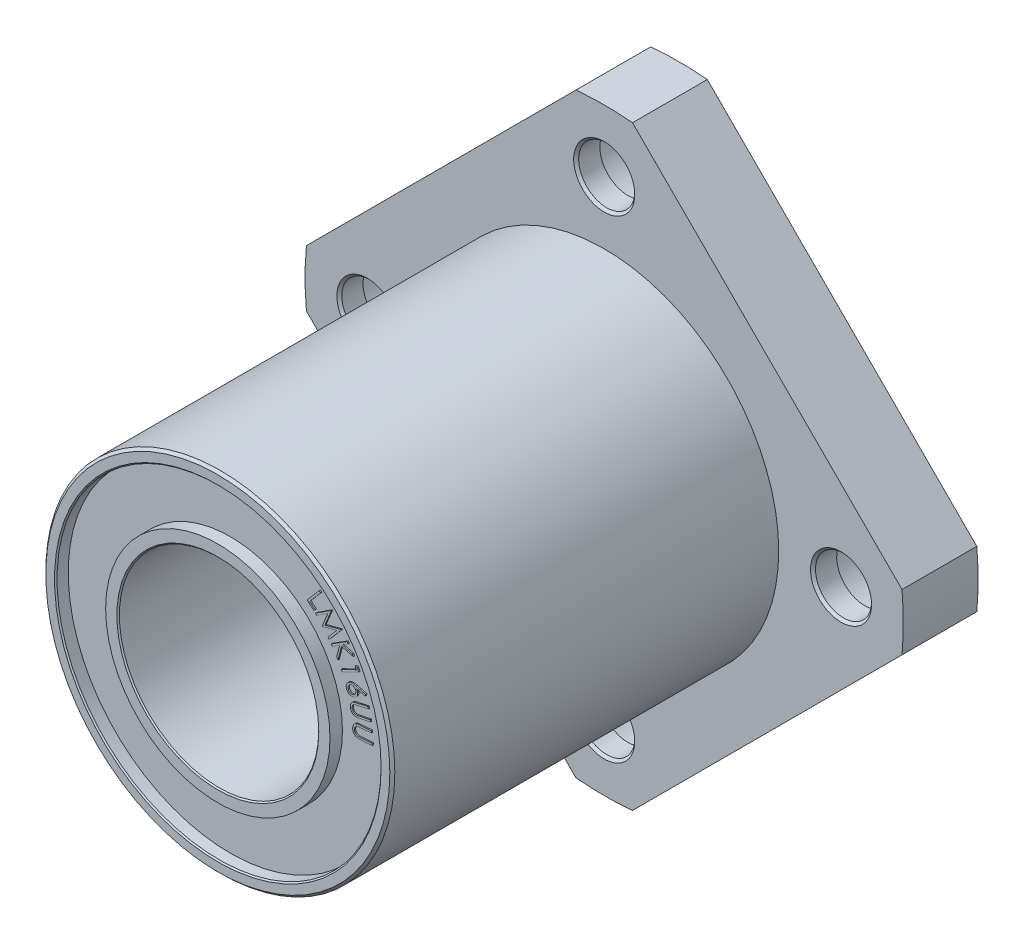
from build123d import *

# Parameters (mm, degrees)
BOSS_EXTRUDE1_DEPTH = 6
SKETCH2_R           = 14
BOSS_EXTRUDE2_DEPTH = 31
SKETCH3_R           = 3.75
CUT_EXTRUDE1_DEPTH  = 4.1
SKETCH4_R           = 2.25
CUT_EXTRUDE2_DEPTH  = 1.9
CHAMFER1_SIZE       = 0.2
SKETCH5_R           = 8
CUT_EXTRUDE3_DEPTH  = 51.209560843
SKETCH6_R           = 13
SKETCH6_R_2         = 9
CUT_EXTRUDE4_DEPTH  = 1
CUT_EXTRUDE5_START  = -1
SKETCH7_R           = 13
SKETCH7_R_2         = 9
CUT_EXTRUDE5_DEPTH  = 1
BOSS_EXTRUDE3_DEPTH = 0.1
CHAMFER2_SIZE       = 0.1
BOSS_EXTRUDE4_DEPTH = 0.1


# Read off the part's stored shape, not the designer's step: CirPattern1
with BuildPart() as part:
    # Sketch1 → Boss-Extrude1 (new body)
    with BuildSketch(Plane.XY):
        with BuildLine():
            Line((-2.270601297, 23.892349607), (-23.892349607, 2.270601297))
            ThreePointArc((-23.892349607, 2.270601297), (-24, 0), (-23.892349607, -2.270601297))
            Line((-23.892349607, -2.270601297), (-2.270601297, -23.892349607))
            ThreePointArc((-2.270601297, -23.892349607), (0, -24), (2.270601297, -23.892349607))
            Line((2.270601297, -23.892349607), (23.892349607, -2.270601297))
            ThreePointArc((23.892349607, -2.270601297), (24, 0), (23.892349607, 2.270601297))
            Line((23.892349607, 2.270601297), (2.270601297, 23.892349607))
            ThreePointArc((2.270601297, 23.892349607), (0, 24), (-2.270601297, 23.892349607))
        make_face()
    extrude(amount=BOSS_EXTRUDE1_DEPTH)

    # Sketch2 → Boss-Extrude2 (add)
    with BuildSketch(Plane.XY.offset(6)):
        Circle(SKETCH2_R)
    extrude(amount=BOSS_EXTRUDE2_DEPTH)

    # Sketch3 → Cut-Extrude1 (cut)
    with BuildSketch(Plane(origin=(0, 0, 0), x_dir=(-1, 0, 0), z_dir=(0, 0, -1))):
        with Locations((0, 19)):
            Circle(SKETCH3_R)
    extrude(amount=-CUT_EXTRUDE1_DEPTH, mode=Mode.SUBTRACT)

    # Sketch4 → Cut-Extrude2 (cut)
    with BuildSketch(Plane(origin=(0, 0, 4.1), x_dir=(-1, 0, 0), z_dir=(0, 0, -1))):
        with Locations((0, 19)):
            Circle(SKETCH4_R)
    extrude(amount=-CUT_EXTRUDE2_DEPTH, mode=Mode.SUBTRACT)

    # Chamfer1
    chamfer1_edges = [part.edges().sort_by_distance(p)[0] for p in [
        (-14, 0, 37),
        (3.75, 19, 0),
        (2.25, 19, 6),
    ]]
    chamfer(chamfer1_edges, length=CHAMFER1_SIZE)

    # CirPattern1 outline → CirPattern1 (revolve, cut)
    with BuildSketch(Plane(origin=(-19, 0, 0), x_dir=(1, 0, 0), z_dir=(0, -1, 0))):
        Polygon((0, 0), (3.95, 0), (3.75, 0.2), (3.75, 4.1), (2.25, 4.1), (2.25, 5.8), (2.45, 6), (0, 6), align=None)
    revolve(axis=Axis((-19, 0, 0), (0, 0, 1)), mode=Mode.SUBTRACT)

    # CirPattern1 2 outline → CirPattern1 2 (revolve, cut)
    with BuildSketch(Plane.XZ.offset(19)):
        Polygon((0, 0), (3.95, 0), (3.75, 0.2), (3.75, 4.1), (2.25, 4.1), (2.25, 5.8), (2.45, 6), (0, 6), align=None)
    revolve(axis=Axis((0, -19, 0), (0, 0, 1)), mode=Mode.SUBTRACT)

    # CirPattern1 3 outline → CirPattern1 3 (revolve, cut)
    with BuildSketch(Plane(origin=(19, 0, 0), x_dir=(1, 0, 0), z_dir=(0, -1, 0))):
        Polygon((0, 0), (3.95, 0), (3.75, 0.2), (3.75, 4.1), (2.25, 4.1), (2.25, 5.8), (2.45, 6), (0, 6), align=None)
    revolve(axis=Axis((19, 0, 0), (0, 0, 1)), mode=Mode.SUBTRACT)

    # Sketch5 → Cut-Extrude3 (cut, through all)
    with BuildSketch(Plane.XY.offset(37)):
        Circle(SKETCH5_R)
    extrude(amount=-CUT_EXTRUDE3_DEPTH, mode=Mode.SUBTRACT)

    # Sketch6 → Cut-Extrude4 (cut)
    with BuildSketch(Plane.XY.offset(37)):
        Circle(SKETCH6_R)
        Circle(SKETCH6_R_2, mode=Mode.SUBTRACT)
    extrude(amount=-CUT_EXTRUDE4_DEPTH, mode=Mode.SUBTRACT)

    # Sketch7 → Cut-Extrude5 (cut)
    with BuildSketch(Plane(origin=(0, 0, 0), x_dir=(-1, 0, 0), z_dir=(0, 0, -1)).offset(CUT_EXTRUDE5_START)):
        with Locations(Location((0, 0, 0), (0, 0, 180))):
            Circle(SKETCH7_R)
        with Locations(Location((0, 0, 0), (0, 0, 180))):
            Circle(SKETCH7_R_2, mode=Mode.SUBTRACT)
    extrude(amount=CUT_EXTRUDE5_DEPTH, mode=Mode.SUBTRACT)

    # Sketch8 → Boss-Extrude3 (add)
    # profile 1 of 7: a face of its own
    with BuildSketch(Plane.XY.offset(36)):
        with BuildLine():
            Line((11.415137259, 1.260998935), (11.425654086, 1.111960473))
            Line((11.425654086, 1.111960473), (10.52511322, 1.047357108))
            add(Edge.make_bspline(
                [(10.52511322, 1.047357108), (10.512391372, 1.046475771), (10.488143423, 1.044795935), (10.453687061, 1.042095703), (10.423029036, 1.039461171), (10.396208389, 1.036629482), (10.373142743, 1.034374521), (10.353907919, 1.031971865), (10.338448907, 1.029688122), (10.329493338, 1.027762745), (10.325593989, 1.026924416)],
                knots=[0, 0, 0, 0, 1.525072541, 2.906801162, 4.133345386, 5.204860418, 6.132162282, 6.904746193, 7.523115038, 8, 8, 8, 8], degree=3))
            add(Edge.make_bspline(
                [(10.325593989, 1.026924416), (10.311588451, 1.023717628), (10.28447674, 1.017509977), (10.246234893, 1.003532982), (10.211836857, 0.98621593), (10.181099719, 0.965110848), (10.153685059, 0.939717023), (10.129952278, 0.908704404), (10.108588135, 0.872847488), (10.090766505, 0.832506456), (10.076511148, 0.78995449), (10.066732056, 0.746697166), (10.061902865, 0.703504793), (10.063019767, 0.674868036), (10.063574759, 0.660638358)],
                knots=[0, 0, 0, 0, 1.043382883, 2.019764934, 2.950812171, 3.835190224, 4.721034932, 5.654412561, 6.663092303, 7.748074903, 8.852970654, 9.919631682, 10.966259617, 12, 12, 12, 12], degree=3))
            add(Edge.make_bspline(
                [(10.063574759, 0.660638358), (10.064748948, 0.648363032), (10.067083882, 0.623952927), (10.076415054, 0.588374651), (10.088098548, 0.553497259), (10.104503384, 0.520402071), (10.123812326, 0.48912192), (10.146625223, 0.460789625), (10.171791171, 0.435061906), (10.200099231, 0.412642724), (10.231132784, 0.39334851), (10.26495601, 0.377484107), (10.301400397, 0.364636232), (10.326925052, 0.358895417), (10.340017066, 0.355950858)],
                knots=[0, 0, 0, 0, 0.998619411, 1.98580514, 2.974994631, 3.977835159, 4.974204828, 5.951175003, 6.922045832, 7.887599396, 8.872777288, 9.879427914, 10.912323838, 12, 12, 12, 12], degree=3))
            add(Edge.make_bspline(
                [(10.340017066, 0.355950858), (10.34541578, 0.355063537), (10.357459005, 0.353084138), (10.377565431, 0.351938052), (10.401403658, 0.350878065), (10.428960691, 0.351216478), (10.460225752, 0.351177345), (10.495074187, 0.353010343), (10.533638896, 0.355034644), (10.560571717, 0.356818481), (10.574692547, 0.357753743)],
                knots=[0, 0, 0, 0, 0.558156925, 1.245112992, 2.053442056, 2.994109282, 4.057521389, 5.244681348, 6.555391349, 8, 8, 8, 8], degree=3))
            Line((10.574692547, 0.357753743), (11.475233412, 0.422357108))
            Line((11.475233412, 0.422357108), (11.485750239, 0.273318646))
            Line((11.485750239, 0.273318646), (10.585209374, 0.208715281))
            add(Edge.make_bspline(
                [(10.585209374, 0.208715281), (10.568988887, 0.207615452), (10.537270226, 0.205464769), (10.490769042, 0.203966696), (10.446479716, 0.204025631), (10.404483142, 0.205092721), (10.364777297, 0.207744087), (10.327502363, 0.212004326), (10.292473797, 0.21730545), (10.259539162, 0.224204707), (10.227991606, 0.232894833), (10.197711601, 0.244437461), (10.168052959, 0.258183982), (10.139588387, 0.275007273), (10.11141359, 0.293492411), (10.084451563, 0.314998062), (10.058161151, 0.338794364), (10.033125974, 0.365076119), (10.009658559, 0.393412318), (9.98897555, 0.423861886), (9.970692667, 0.455932401), (9.955500839, 0.489904774), (9.942794527, 0.525559116), (9.932864333, 0.562826672), (9.925955641, 0.601954242), (9.923369394, 0.628664965), (9.922048316, 0.642309031)],
                knots=[0, 0, 0, 0, 1.29790519, 2.538013593, 3.713504963, 4.833477405, 5.891471315, 6.889342099, 7.828041886, 8.718857869, 9.574525008, 10.437447634, 11.303144641, 12.180944757, 13.074734734, 13.991411698, 14.931132735, 15.903953804, 16.886877875, 17.865008677, 18.839012189, 19.830389656, 20.831970248, 21.858054395, 22.90587578, 24, 24, 24, 24], degree=3))
            add(Edge.make_bspline(
                [(9.922048316, 0.642309031), (9.921262384, 0.657127623), (9.919717529, 0.686255574), (9.920601945, 0.729338353), (9.924530997, 0.770899719), (9.931172318, 0.811057158), (9.940357212, 0.849900984), (9.952776226, 0.887236584), (9.967892546, 0.923175888), (9.98548152, 0.957585544), (10.005607491, 0.990030884), (10.027819258, 1.020075532), (10.051980902, 1.047691777), (10.078223384, 1.072482659), (10.105926121, 1.095449658), (10.13608798, 1.115113273), (10.168053714, 1.132430839), (10.190490061, 1.141796388), (10.201795912, 1.146515762)],
                knots=[0, 0, 0, 0, 1.150349316, 2.261167586, 3.337655153, 4.384602257, 5.41497043, 6.42926185, 7.431710093, 8.435511189, 9.422558622, 10.388700234, 11.329699416, 12.263524504, 13.185355934, 14.115881161, 15.050577791, 16, 16, 16, 16], degree=3))
            add(Edge.make_bspline(
                [(10.201795912, 1.146515762), (10.209672645, 1.149334886), (10.22663518, 1.155405865), (10.254843223, 1.162632745), (10.287282385, 1.169889306), (10.32416981, 1.176452641), (10.365508546, 1.181968832), (10.411189637, 1.187344485), (10.461347577, 1.192613247), (10.496358047, 1.19510008), (10.514596393, 1.19639557)],
                knots=[0, 0, 0, 0, 0.63178644, 1.360551357, 2.197781047, 3.143358464, 4.190032368, 5.348333603, 6.618641489, 8, 8, 8, 8], degree=3))
            Line((10.514596393, 1.19639557), (11.415137259, 1.260998935))
        make_face()
    # profile 2 of 7: a face of its own
    with BuildSketch(Plane.XY.offset(36)):
        with BuildLine():
            Line((11.139128228, 2.809397239), (11.170678709, 2.663363585))
            Line((11.170678709, 2.663363585), (10.286664286, 2.472257816))
            add(Edge.make_bspline(
                [(10.286664286, 2.472257816), (10.274143383, 2.46955864), (10.250386782, 2.464437344), (10.216669763, 2.45708698), (10.186920932, 2.449653343), (10.160725192, 2.443466028), (10.138185915, 2.43775622), (10.119339797, 2.432703256), (10.104259171, 2.428333519), (10.095647169, 2.425217247), (10.091952748, 2.423880412)],
                knots=[0, 0, 0, 0, 1.531423077, 2.905653596, 4.12553918, 5.197303879, 6.123816941, 6.905239634, 7.530364024, 8, 8, 8, 8], degree=3))
            add(Edge.make_bspline(
                [(10.091952748, 2.423880412), (10.07849968, 2.418772179), (10.05238323, 2.408855562), (10.016527178, 2.389471955), (9.984836589, 2.367432873), (9.957276334, 2.342271867), (9.933964761, 2.312932029), (9.914254712, 2.279182209), (9.8986246, 2.240417753), (9.886223971, 2.198051791), (9.877846932, 2.153769767), (9.87449667, 2.109433195), (9.876097582, 2.065924142), (9.881181399, 2.037720924), (9.883719574, 2.023640027)],
                knots=[0, 0, 0, 0, 1.042784615, 2.024358541, 2.947413012, 3.836807914, 4.720607584, 5.655054889, 6.661475998, 7.744185415, 8.852688997, 9.923562491, 10.963306172, 12, 12, 12, 12], degree=3))
            add(Edge.make_bspline(
                [(9.883719574, 2.023640027), (9.886637118, 2.011732182), (9.892457137, 1.987977991), (9.906343536, 1.953923222), (9.923515655, 1.921286225), (9.944120679, 1.89053096), (9.967791419, 1.862207094), (9.994361632, 1.837276172), (10.023107889, 1.815436438), (10.054124627, 1.796869803), (10.087812227, 1.782633257), (10.123359185, 1.771306467), (10.161315481, 1.764142589), (10.18737823, 1.762077507), (10.200726786, 1.761019835)],
                knots=[0, 0, 0, 0, 0.992542382, 1.979958752, 2.971338459, 3.977793662, 4.974609623, 5.956638373, 6.924335101, 7.896143417, 8.877903688, 9.881834677, 10.915139429, 12, 12, 12, 12], degree=3))
            add(Edge.make_bspline(
                [(10.200726786, 1.761019835), (10.206235967, 1.760975525), (10.218463057, 1.760877183), (10.238634851, 1.761795582), (10.262393242, 1.764294639), (10.289592475, 1.768379641), (10.320462761, 1.773165402), (10.354859224, 1.779090399), (10.392777202, 1.786753917), (10.419181185, 1.792347509), (10.432998421, 1.795274643)],
                knots=[0, 0, 0, 0, 0.562056896, 1.24743041, 2.058877369, 2.998267398, 4.053373643, 5.246223677, 6.558945556, 8, 8, 8, 8], degree=3))
            Line((10.432998421, 1.795274643), (11.317012844, 1.986380412))
            Line((11.317012844, 1.986380412), (11.348563324, 1.840046277))
            Line((11.348563324, 1.840046277), (10.464548901, 1.648940508))
            add(Edge.make_bspline(
                [(10.464548901, 1.648940508), (10.448535743, 1.645673637), (10.417371989, 1.639315869), (10.371524813, 1.631032292), (10.327800009, 1.624868686), (10.286145006, 1.619857956), (10.246545993, 1.616869235), (10.208945502, 1.615557566), (10.173458524, 1.616272763), (10.139699835, 1.618075532), (10.107264631, 1.62271485), (10.075475148, 1.629574043), (10.04428157, 1.639296767), (10.013467523, 1.651271076), (9.983287476, 1.666172671), (9.953468898, 1.683654062), (9.924127781, 1.703831572), (9.895334401, 1.726185697), (9.868054853, 1.750960099), (9.843070865, 1.77814036), (9.820272369, 1.807319876), (9.800690943, 1.83911449), (9.78270622, 1.87245182), (9.767645777, 1.90816707), (9.755446535, 1.946057308), (9.749044989, 1.972214975), (9.745798901, 1.985478969)],
                knots=[0, 0, 0, 0, 1.302698352, 2.535225709, 3.712849897, 4.821988615, 5.878864123, 6.877344351, 7.819562771, 8.707520028, 9.570135128, 10.428305255, 11.297031741, 12.171754054, 13.060823253, 13.976870013, 14.924653063, 15.897263205, 16.880594818, 17.858042546, 18.836956421, 19.827103014, 20.830708993, 21.853876358, 22.911746516, 24, 24, 24, 24], degree=3))
            add(Edge.make_bspline(
                [(9.745798901, 1.985478969), (9.742894087, 2.000069532), (9.73719131, 2.028713949), (9.732190665, 2.071596021), (9.729830694, 2.113368279), (9.731371094, 2.154114395), (9.734609902, 2.193944693), (9.741708837, 2.232804368), (9.751545152, 2.270712545), (9.764517116, 2.307356572), (9.780025294, 2.342304226), (9.797871393, 2.37521598), (9.81761657, 2.406048099), (9.840056839, 2.434426869), (9.864668405, 2.460596475), (9.891661244, 2.484464249), (9.920723686, 2.506244979), (9.941689574, 2.518620659), (9.95222919, 2.52484195)],
                knots=[0, 0, 0, 0, 1.151260563, 2.260172568, 3.339326473, 4.386558457, 5.414290122, 6.430313554, 7.440253402, 8.443263907, 9.436031966, 10.397074162, 11.339097701, 12.266714788, 13.193715939, 14.116459176, 15.053138357, 16, 16, 16, 16], degree=3))
            add(Edge.make_bspline(
                [(9.95222919, 2.52484195), (9.959584835, 2.528766381), (9.975497483, 2.537256197), (10.002421014, 2.548263495), (10.033414136, 2.560282819), (10.069209979, 2.571282244), (10.109339106, 2.583129269), (10.153881904, 2.595129878), (10.203053465, 2.606710324), (10.237276779, 2.614323512), (10.255113805, 2.618291469)],
                knots=[0, 0, 0, 0, 0.629050558, 1.360840431, 2.19368298, 3.138318759, 4.18640299, 5.353024841, 6.62040929, 8, 8, 8, 8], degree=3))
            Line((10.255113805, 2.618291469), (11.139128228, 2.809397239))
        make_face()
    # profile 3 of 7: a face of its own
    with BuildSketch(Plane.XY.offset(36)):
        with BuildLine():
            Line((10.966722572, 3.567919023), (10.932768245, 3.424589696))
            Line((10.932768245, 3.424589696), (10.219126418, 3.597366138))
            add(Edge.make_bspline(
                [(10.219126418, 3.597366138), (10.227615966, 3.58627252), (10.244181319, 3.564625936), (10.265433691, 3.53093879), (10.283330777, 3.497386051), (10.292260851, 3.474366543), (10.296650457, 3.463051235)],
                knots=[0, 0, 0, 0, 1.075782338, 2.099135818, 3.065624441, 4, 4, 4, 4], degree=3))
            add(Edge.make_bspline(
                [(10.296650457, 3.463051235), (10.301226448, 3.449205571), (10.310237376, 3.421941032), (10.318964775, 3.380154347), (10.323255896, 3.338559513), (10.322883009, 3.29716028), (10.318355197, 3.256085699), (10.309579879, 3.215185031), (10.296267423, 3.174514814), (10.278612935, 3.134633049), (10.257355739, 3.096342586), (10.233126708, 3.060462438), (10.205452697, 3.027707136), (10.174858295, 2.998015168), (10.141189071, 2.971247454), (10.104204594, 2.947869524), (10.064410624, 2.926941872), (10.036054731, 2.916001448), (10.021710553, 2.9104671)],
                knots=[0, 0, 0, 0, 1.017074609, 2.002798269, 2.972403428, 3.930092473, 4.886530655, 5.851741466, 6.84428238, 7.867750661, 8.890932442, 9.897187829, 10.884397506, 11.878020906, 12.868195925, 13.88040654, 14.927777567, 16, 16, 16, 16], degree=3))
            add(Edge.make_bspline(
                [(10.021710553, 2.9104671), (10.001617188, 2.904005582), (9.962184408, 2.891324998), (9.90136161, 2.881984825), (9.841058855, 2.879823241), (9.781520251, 2.886645956), (9.723560351, 2.901005037), (9.6680872, 2.923407259), (9.615732761, 2.953957461), (9.566689616, 2.991303943), (9.522455722, 3.034934927), (9.484203373, 3.08374399), (9.452570887, 3.137237802), (9.437002451, 3.175669101), (9.429162476, 3.195022388)],
                knots=[0, 0, 0, 0, 1.035583084, 2.032308712, 3.012040077, 3.992401538, 4.966319379, 5.937710129, 6.921043641, 7.935792001, 8.958847054, 9.964919324, 10.97517117, 12, 12, 12, 12], degree=3))
            add(Edge.make_bspline(
                [(9.429162476, 3.195022388), (9.422886656, 3.214311853), (9.410487292, 3.252422743), (9.401895726, 3.311710151), (9.40019016, 3.37114959), (9.406534375, 3.430478163), (9.420549624, 3.48842535), (9.442375443, 3.543655447), (9.471847302, 3.595509559), (9.508521342, 3.643328952), (9.55097213, 3.686517643), (9.598528495, 3.723595253), (9.650117741, 3.754923312), (9.68743381, 3.769846816), (9.706205745, 3.777354119)],
                knots=[0, 0, 0, 0, 1.015578588, 2.006515133, 2.991271671, 3.991330954, 4.989028879, 5.972080388, 6.95951031, 7.970096229, 8.985861099, 9.987596464, 10.987655747, 12, 12, 12, 12], degree=3))
            add(Edge.make_bspline(
                [(9.706205745, 3.777354119), (9.720949138, 3.782150045), (9.750963742, 3.791913592), (9.798420675, 3.801360863), (9.848502228, 3.806487028), (9.892102098, 3.808235417), (9.928890991, 3.806940508), (9.958656577, 3.804824717), (9.990312411, 3.801431864), (10.023814798, 3.797047281), (10.059045766, 3.790877327), (10.096098063, 3.783604489), (10.13503406, 3.775364966), (10.161454425, 3.768727012), (10.174955745, 3.765334888)],
                knots=[0, 0, 0, 0, 1.172014849, 2.38598819, 3.651065959, 4.977739284, 5.682723884, 6.434673868, 7.234564036, 8.090712896, 8.990026005, 9.939514725, 10.94705193, 12, 12, 12, 12], degree=3))
            Line((10.174955745, 3.765334888), (10.966722572, 3.567919023))
        make_face()
        with BuildLine():
            add(Edge.make_bspline(
                [(10.16113363, 3.451933446), (10.157221517, 3.461936068), (10.149553211, 3.481542654), (10.134841003, 3.509166416), (10.118146611, 3.534707987), (10.098912978, 3.558075545), (10.07767233, 3.579552558), (10.053563231, 3.598481057), (10.027539788, 3.615693331), (9.999320366, 3.630193927), (9.970134012, 3.642500925), (9.940294597, 3.651980263), (9.910145977, 3.657884186), (9.879962294, 3.661063292), (9.849540774, 3.660630309), (9.818972454, 3.657287923), (9.78808521, 3.65113853), (9.768041485, 3.644366293), (9.757888437, 3.64093585)],
                knots=[0, 0, 0, 0, 1.039781524, 2.038122176, 3.02584289, 3.991242346, 4.965573684, 5.946070518, 6.955339238, 7.983967648, 9.014790664, 10.021443725, 11.01102164, 11.986222357, 12.956631854, 13.952138989, 14.962666411, 16, 16, 16, 16], degree=3))
            add(Edge.make_bspline(
                [(9.757888437, 3.64093585), (9.747885979, 3.637023614), (9.728279713, 3.629355066), (9.70065363, 3.61464461), (9.675120646, 3.597943736), (9.651721667, 3.578733822), (9.630318212, 3.557359678), (9.610943222, 3.533576148), (9.594259218, 3.507143778), (9.579236012, 3.479228206), (9.567042152, 3.449920819), (9.557590237, 3.420191273), (9.551574746, 3.390154289), (9.548576403, 3.360065149), (9.548467837, 3.329742234), (9.55195793, 3.299371499), (9.558120932, 3.268699065), (9.564857029, 3.248746226), (9.568285072, 3.2385921)],
                knots=[0, 0, 0, 0, 1.04130416, 2.041106763, 3.030273876, 3.997087043, 4.972845174, 5.960865979, 6.966319891, 8.00098249, 9.033315022, 10.041442207, 11.022941985, 11.999570766, 12.971352725, 13.958656413, 14.96114736, 16, 16, 16, 16], degree=3))
            add(Edge.make_bspline(
                [(9.568285072, 3.2385921), (9.572197308, 3.228589641), (9.579865856, 3.208983376), (9.594576312, 3.181357293), (9.611277186, 3.15582431), (9.630487098, 3.132425323), (9.651861249, 3.1110219), (9.675644755, 3.09164679), (9.702077214, 3.074963242), (9.729992446, 3.059938286), (9.759301097, 3.047750931), (9.789119789, 3.038245637), (9.81927401, 3.032312207), (9.849455, 3.029273701), (9.879779509, 3.02917323), (9.91014981, 3.032661121), (9.940822362, 3.038824718), (9.960775185, 3.045560734), (9.970929303, 3.048988735)],
                knots=[0, 0, 0, 0, 1.04068448, 2.039892102, 3.028470562, 3.99470838, 4.969885838, 5.957318673, 6.96217424, 7.996221112, 9.027939304, 10.035466553, 11.025903828, 12.001951418, 12.97315507, 13.959871215, 14.96176558, 16, 16, 16, 16], degree=3))
            add(Edge.make_bspline(
                [(9.970929303, 3.048988735), (9.980923754, 3.052916449), (10.00059692, 3.060647795), (10.028409822, 3.075192517), (10.054117051, 3.092060665), (10.077585992, 3.111403886), (10.099103491, 3.132862036), (10.118474743, 3.15664982), (10.135159354, 3.183081101), (10.150184016, 3.210996659), (10.16237145, 3.240305222), (10.171876723, 3.270123938), (10.177810158, 3.300278152), (10.180848662, 3.330459144), (10.180949134, 3.360783652), (10.177461243, 3.391153954), (10.171297646, 3.421826506), (10.16456163, 3.441779329), (10.16113363, 3.451933446)],
                knots=[0, 0, 0, 0, 1.039238112, 2.045645504, 3.032850014, 4.01139362, 4.985215752, 5.97127623, 6.974735224, 8.007344954, 9.03762924, 10.043756203, 11.032816945, 12.007508001, 12.977361851, 13.962706634, 14.963208543, 16, 16, 16, 16], degree=3))
        make_face(mode=Mode.SUBTRACT)
    # profile 4 of 7: a face of its own
    with BuildSketch(Plane.XY.offset(36)):
        Polygon((10.288198727, 5.100657161), (10.41440065, 4.83473168), (9.060734784, 4.192003315), (8.997032861, 4.326318218), (10.218186708, 4.905945622), (10.117225169, 5.118686007), align=None)
    # profile 5 of 7: a face of its own
    with BuildSketch(Plane.XY.offset(36)):
        Polygon((9.465301099, 6.489720509), (9.546430907, 6.36141522), (9.074676099, 6.063338297), (9.863438118, 5.859912816), (9.971010234, 5.689840701), (9.024796291, 5.937737336), (8.743546291, 4.848494547), (8.638378022, 5.014960893), (8.87575783, 5.937436855), (8.289519849, 5.566944066), (8.208390041, 5.695249355), align=None)
    # profile 6 of 7: a face of its own
    with BuildSketch(Plane.XY.offset(36)):
        Polygon((6.932735619, 7.192643223), (8.190548119, 8.012955723), (8.206173119, 7.994926877), (7.686641869, 6.736513415), (8.998540907, 7.0898788), (9.014466388, 7.071549473), (8.036401484, 5.931825915), (7.939646676, 6.042102358), (8.64427408, 6.851898031), (7.497939946, 6.54691005), (7.473300523, 6.575155242), (7.928528888, 7.681825915), (7.02708658, 7.084770627), align=None)
    # profile 7 of 7: a face of its own
    with BuildSketch(Plane.XY.offset(36)):
        Polygon((7.23841632, 8.915296556), (7.352298531, 8.817640306), (6.475495647, 7.794503287), (6.910591801, 7.421606652), (6.816841801, 7.312231652), (6.267863435, 7.782784537), align=None)
    extrude(amount=BOSS_EXTRUDE3_DEPTH)

    # Chamfer2
    chamfer2_edges = [part.edges().sort_by_distance(p)[0] for p in [
        (-8, 0, 0),
        (-8, 0, 37),
        (-13, 0, 37),
    ]]
    chamfer(chamfer2_edges, length=CHAMFER2_SIZE)

    # Sketch9 → Boss-Extrude4 (add)
    # profile 1 of 7: a face of its own
    with BuildSketch(Plane(origin=(0, 0, 1), x_dir=(-1, 0, 0), z_dir=(0, 0, -1))):
        with BuildLine():
            Line((11.415137259, 1.260998935), (11.425654086, 1.111960473))
            Line((11.425654086, 1.111960473), (10.52511322, 1.047357108))
            add(Edge.make_bspline(
                [(10.52511322, 1.047357108), (10.512391372, 1.046475771), (10.488143423, 1.044795935), (10.453687061, 1.042095703), (10.423029036, 1.039461171), (10.396208389, 1.036629482), (10.373142743, 1.034374521), (10.353907919, 1.031971865), (10.338448907, 1.029688122), (10.329493338, 1.027762745), (10.325593989, 1.026924416)],
                knots=[0, 0, 0, 0, 1.525072541, 2.906801162, 4.133345386, 5.204860418, 6.132162282, 6.904746193, 7.523115038, 8, 8, 8, 8], degree=3))
            add(Edge.make_bspline(
                [(10.325593989, 1.026924416), (10.311588451, 1.023717628), (10.28447674, 1.017509977), (10.246234893, 1.003532982), (10.211836857, 0.98621593), (10.181099719, 0.965110848), (10.153685059, 0.939717023), (10.129952278, 0.908704404), (10.108588135, 0.872847488), (10.090766505, 0.832506456), (10.076511148, 0.78995449), (10.066732056, 0.746697166), (10.061902865, 0.703504793), (10.063019767, 0.674868036), (10.063574759, 0.660638358)],
                knots=[0, 0, 0, 0, 1.043382883, 2.019764934, 2.950812171, 3.835190224, 4.721034932, 5.654412561, 6.663092303, 7.748074903, 8.852970654, 9.919631682, 10.966259617, 12, 12, 12, 12], degree=3))
            add(Edge.make_bspline(
                [(10.063574759, 0.660638358), (10.064748948, 0.648363032), (10.067083882, 0.623952927), (10.076415054, 0.588374651), (10.088098548, 0.553497259), (10.104503384, 0.520402071), (10.123812326, 0.48912192), (10.146625223, 0.460789625), (10.171791171, 0.435061906), (10.200099231, 0.412642724), (10.231132784, 0.39334851), (10.26495601, 0.377484107), (10.301400397, 0.364636232), (10.326925052, 0.358895417), (10.340017066, 0.355950858)],
                knots=[0, 0, 0, 0, 0.998619411, 1.98580514, 2.974994631, 3.977835159, 4.974204828, 5.951175003, 6.922045832, 7.887599396, 8.872777288, 9.879427914, 10.912323838, 12, 12, 12, 12], degree=3))
            add(Edge.make_bspline(
                [(10.340017066, 0.355950858), (10.34541578, 0.355063537), (10.357459005, 0.353084138), (10.377565431, 0.351938052), (10.401403658, 0.350878065), (10.428960691, 0.351216478), (10.460225752, 0.351177345), (10.495074187, 0.353010343), (10.533638896, 0.355034644), (10.560571717, 0.356818481), (10.574692547, 0.357753743)],
                knots=[0, 0, 0, 0, 0.558156925, 1.245112992, 2.053442056, 2.994109282, 4.057521389, 5.244681348, 6.555391349, 8, 8, 8, 8], degree=3))
            Line((10.574692547, 0.357753743), (11.475233412, 0.422357108))
            Line((11.475233412, 0.422357108), (11.485750239, 0.273318646))
            Line((11.485750239, 0.273318646), (10.585209374, 0.208715281))
            add(Edge.make_bspline(
                [(10.585209374, 0.208715281), (10.568988887, 0.207615452), (10.537270226, 0.205464769), (10.490769042, 0.203966696), (10.446479716, 0.204025631), (10.404483142, 0.205092721), (10.364777297, 0.207744087), (10.327502363, 0.212004326), (10.292473797, 0.21730545), (10.259539162, 0.224204707), (10.227991606, 0.232894833), (10.197711601, 0.244437461), (10.168052959, 0.258183982), (10.139588387, 0.275007273), (10.11141359, 0.293492411), (10.084451563, 0.314998062), (10.058161151, 0.338794364), (10.033125974, 0.365076119), (10.009658559, 0.393412318), (9.98897555, 0.423861886), (9.970692667, 0.455932401), (9.955500839, 0.489904774), (9.942794527, 0.525559116), (9.932864333, 0.562826672), (9.925955641, 0.601954242), (9.923369394, 0.628664965), (9.922048316, 0.642309031)],
                knots=[0, 0, 0, 0, 1.29790519, 2.538013593, 3.713504963, 4.833477405, 5.891471315, 6.889342099, 7.828041886, 8.718857869, 9.574525008, 10.437447634, 11.303144641, 12.180944757, 13.074734734, 13.991411698, 14.931132735, 15.903953804, 16.886877875, 17.865008677, 18.839012189, 19.830389656, 20.831970248, 21.858054395, 22.90587578, 24, 24, 24, 24], degree=3))
            add(Edge.make_bspline(
                [(9.922048316, 0.642309031), (9.921262384, 0.657127623), (9.919717529, 0.686255574), (9.920601945, 0.729338353), (9.924530997, 0.770899719), (9.931172318, 0.811057158), (9.940357212, 0.849900984), (9.952776226, 0.887236584), (9.967892546, 0.923175888), (9.98548152, 0.957585544), (10.005607491, 0.990030884), (10.027819258, 1.020075532), (10.051980902, 1.047691777), (10.078223384, 1.072482659), (10.105926121, 1.095449658), (10.13608798, 1.115113273), (10.168053714, 1.132430839), (10.190490061, 1.141796388), (10.201795912, 1.146515762)],
                knots=[0, 0, 0, 0, 1.150349316, 2.261167586, 3.337655153, 4.384602257, 5.41497043, 6.42926185, 7.431710093, 8.435511189, 9.422558622, 10.388700234, 11.329699416, 12.263524504, 13.185355934, 14.115881161, 15.050577791, 16, 16, 16, 16], degree=3))
            add(Edge.make_bspline(
                [(10.201795912, 1.146515762), (10.209672645, 1.149334886), (10.22663518, 1.155405865), (10.254843223, 1.162632745), (10.287282385, 1.169889306), (10.32416981, 1.176452641), (10.365508546, 1.181968832), (10.411189637, 1.187344485), (10.461347577, 1.192613247), (10.496358047, 1.19510008), (10.514596393, 1.19639557)],
                knots=[0, 0, 0, 0, 0.63178644, 1.360551357, 2.197781047, 3.143358464, 4.190032368, 5.348333603, 6.618641489, 8, 8, 8, 8], degree=3))
            Line((10.514596393, 1.19639557), (11.415137259, 1.260998935))
        make_face()
    # profile 2 of 7: a face of its own
    with BuildSketch(Plane(origin=(0, 0, 1), x_dir=(-1, 0, 0), z_dir=(0, 0, -1))):
        with BuildLine():
            Line((11.139128228, 2.809397239), (11.170678709, 2.663363585))
            Line((11.170678709, 2.663363585), (10.286664286, 2.472257816))
            add(Edge.make_bspline(
                [(10.286664286, 2.472257816), (10.274143383, 2.46955864), (10.250386782, 2.464437344), (10.216669763, 2.45708698), (10.186920932, 2.449653343), (10.160725192, 2.443466028), (10.138185915, 2.43775622), (10.119339797, 2.432703256), (10.104259171, 2.428333519), (10.095647169, 2.425217247), (10.091952748, 2.423880412)],
                knots=[0, 0, 0, 0, 1.531423077, 2.905653596, 4.12553918, 5.197303879, 6.123816941, 6.905239634, 7.530364024, 8, 8, 8, 8], degree=3))
            add(Edge.make_bspline(
                [(10.091952748, 2.423880412), (10.07849968, 2.418772179), (10.05238323, 2.408855562), (10.016527178, 2.389471955), (9.984836589, 2.367432873), (9.957276334, 2.342271867), (9.933964761, 2.312932029), (9.914254712, 2.279182209), (9.8986246, 2.240417753), (9.886223971, 2.198051791), (9.877846932, 2.153769767), (9.87449667, 2.109433195), (9.876097582, 2.065924142), (9.881181399, 2.037720924), (9.883719574, 2.023640027)],
                knots=[0, 0, 0, 0, 1.042784615, 2.024358541, 2.947413012, 3.836807914, 4.720607584, 5.655054889, 6.661475998, 7.744185415, 8.852688997, 9.923562491, 10.963306172, 12, 12, 12, 12], degree=3))
            add(Edge.make_bspline(
                [(9.883719574, 2.023640027), (9.886637118, 2.011732182), (9.892457137, 1.987977991), (9.906343536, 1.953923222), (9.923515655, 1.921286225), (9.944120679, 1.89053096), (9.967791419, 1.862207094), (9.994361632, 1.837276172), (10.023107889, 1.815436438), (10.054124627, 1.796869803), (10.087812227, 1.782633257), (10.123359185, 1.771306467), (10.161315481, 1.764142589), (10.18737823, 1.762077507), (10.200726786, 1.761019835)],
                knots=[0, 0, 0, 0, 0.992542382, 1.979958752, 2.971338459, 3.977793662, 4.974609623, 5.956638373, 6.924335101, 7.896143417, 8.877903688, 9.881834677, 10.915139429, 12, 12, 12, 12], degree=3))
            add(Edge.make_bspline(
                [(10.200726786, 1.761019835), (10.206235967, 1.760975525), (10.218463057, 1.760877183), (10.238634851, 1.761795582), (10.262393242, 1.764294639), (10.289592475, 1.768379641), (10.320462761, 1.773165402), (10.354859224, 1.779090399), (10.392777202, 1.786753917), (10.419181185, 1.792347509), (10.432998421, 1.795274643)],
                knots=[0, 0, 0, 0, 0.562056896, 1.24743041, 2.058877369, 2.998267398, 4.053373643, 5.246223677, 6.558945556, 8, 8, 8, 8], degree=3))
            Line((10.432998421, 1.795274643), (11.317012844, 1.986380412))
            Line((11.317012844, 1.986380412), (11.348563324, 1.840046277))
            Line((11.348563324, 1.840046277), (10.464548901, 1.648940508))
            add(Edge.make_bspline(
                [(10.464548901, 1.648940508), (10.448535743, 1.645673637), (10.417371989, 1.639315869), (10.371524813, 1.631032292), (10.327800009, 1.624868686), (10.286145006, 1.619857956), (10.246545993, 1.616869235), (10.208945502, 1.615557566), (10.173458524, 1.616272763), (10.139699835, 1.618075532), (10.107264631, 1.62271485), (10.075475148, 1.629574043), (10.04428157, 1.639296767), (10.013467523, 1.651271076), (9.983287476, 1.666172671), (9.953468898, 1.683654062), (9.924127781, 1.703831572), (9.895334401, 1.726185697), (9.868054853, 1.750960099), (9.843070865, 1.77814036), (9.820272369, 1.807319876), (9.800690943, 1.83911449), (9.78270622, 1.87245182), (9.767645777, 1.90816707), (9.755446535, 1.946057308), (9.749044989, 1.972214975), (9.745798901, 1.985478969)],
                knots=[0, 0, 0, 0, 1.302698352, 2.535225709, 3.712849897, 4.821988615, 5.878864123, 6.877344351, 7.819562771, 8.707520028, 9.570135128, 10.428305255, 11.297031741, 12.171754054, 13.060823253, 13.976870013, 14.924653063, 15.897263205, 16.880594818, 17.858042546, 18.836956421, 19.827103014, 20.830708993, 21.853876358, 22.911746516, 24, 24, 24, 24], degree=3))
            add(Edge.make_bspline(
                [(9.745798901, 1.985478969), (9.742894087, 2.000069532), (9.73719131, 2.028713949), (9.732190665, 2.071596021), (9.729830694, 2.113368279), (9.731371094, 2.154114395), (9.734609902, 2.193944693), (9.741708837, 2.232804368), (9.751545152, 2.270712545), (9.764517116, 2.307356572), (9.780025294, 2.342304226), (9.797871393, 2.37521598), (9.81761657, 2.406048099), (9.840056839, 2.434426869), (9.864668405, 2.460596475), (9.891661244, 2.484464249), (9.920723686, 2.506244979), (9.941689574, 2.518620659), (9.95222919, 2.52484195)],
                knots=[0, 0, 0, 0, 1.151260563, 2.260172568, 3.339326473, 4.386558457, 5.414290122, 6.430313554, 7.440253402, 8.443263907, 9.436031966, 10.397074162, 11.339097701, 12.266714788, 13.193715939, 14.116459176, 15.053138357, 16, 16, 16, 16], degree=3))
            add(Edge.make_bspline(
                [(9.95222919, 2.52484195), (9.959584835, 2.528766381), (9.975497483, 2.537256197), (10.002421014, 2.548263495), (10.033414136, 2.560282819), (10.069209979, 2.571282244), (10.109339106, 2.583129269), (10.153881904, 2.595129878), (10.203053465, 2.606710324), (10.237276779, 2.614323512), (10.255113805, 2.618291469)],
                knots=[0, 0, 0, 0, 0.629050558, 1.360840431, 2.19368298, 3.138318759, 4.18640299, 5.353024841, 6.62040929, 8, 8, 8, 8], degree=3))
            Line((10.255113805, 2.618291469), (11.139128228, 2.809397239))
        make_face()
    # profile 3 of 7: a face of its own
    with BuildSketch(Plane(origin=(0, 0, 1), x_dir=(-1, 0, 0), z_dir=(0, 0, -1))):
        with BuildLine():
            Line((10.966722572, 3.567919023), (10.932768245, 3.424589696))
            Line((10.932768245, 3.424589696), (10.219126418, 3.597366138))
            add(Edge.make_bspline(
                [(10.219126418, 3.597366138), (10.227615966, 3.58627252), (10.244181319, 3.564625936), (10.265433691, 3.53093879), (10.283330777, 3.497386051), (10.292260851, 3.474366543), (10.296650457, 3.463051235)],
                knots=[0, 0, 0, 0, 1.075782338, 2.099135818, 3.065624441, 4, 4, 4, 4], degree=3))
            add(Edge.make_bspline(
                [(10.296650457, 3.463051235), (10.301226448, 3.449205571), (10.310237376, 3.421941032), (10.318964775, 3.380154347), (10.323255896, 3.338559513), (10.322883009, 3.29716028), (10.318355197, 3.256085699), (10.309579879, 3.215185031), (10.296267423, 3.174514814), (10.278612935, 3.134633049), (10.257355739, 3.096342586), (10.233126708, 3.060462438), (10.205452697, 3.027707136), (10.174858295, 2.998015168), (10.141189071, 2.971247454), (10.104204594, 2.947869524), (10.064410624, 2.926941872), (10.036054731, 2.916001448), (10.021710553, 2.9104671)],
                knots=[0, 0, 0, 0, 1.017074609, 2.002798269, 2.972403428, 3.930092473, 4.886530655, 5.851741466, 6.84428238, 7.867750661, 8.890932442, 9.897187829, 10.884397506, 11.878020906, 12.868195925, 13.88040654, 14.927777567, 16, 16, 16, 16], degree=3))
            add(Edge.make_bspline(
                [(10.021710553, 2.9104671), (10.001617188, 2.904005582), (9.962184408, 2.891324998), (9.90136161, 2.881984825), (9.841058855, 2.879823241), (9.781520251, 2.886645956), (9.723560351, 2.901005037), (9.6680872, 2.923407259), (9.615732761, 2.953957461), (9.566689616, 2.991303943), (9.522455722, 3.034934927), (9.484203373, 3.08374399), (9.452570887, 3.137237802), (9.437002451, 3.175669101), (9.429162476, 3.195022388)],
                knots=[0, 0, 0, 0, 1.035583084, 2.032308712, 3.012040077, 3.992401538, 4.966319379, 5.937710129, 6.921043641, 7.935792001, 8.958847054, 9.964919324, 10.97517117, 12, 12, 12, 12], degree=3))
            add(Edge.make_bspline(
                [(9.429162476, 3.195022388), (9.422886656, 3.214311853), (9.410487292, 3.252422743), (9.401895726, 3.311710151), (9.40019016, 3.37114959), (9.406534375, 3.430478163), (9.420549624, 3.48842535), (9.442375443, 3.543655447), (9.471847302, 3.595509559), (9.508521342, 3.643328952), (9.55097213, 3.686517643), (9.598528495, 3.723595253), (9.650117741, 3.754923312), (9.68743381, 3.769846816), (9.706205745, 3.777354119)],
                knots=[0, 0, 0, 0, 1.015578588, 2.006515133, 2.991271671, 3.991330954, 4.989028879, 5.972080388, 6.95951031, 7.970096229, 8.985861099, 9.987596464, 10.987655747, 12, 12, 12, 12], degree=3))
            add(Edge.make_bspline(
                [(9.706205745, 3.777354119), (9.720949138, 3.782150045), (9.750963742, 3.791913592), (9.798420675, 3.801360863), (9.848502228, 3.806487028), (9.892102098, 3.808235417), (9.928890991, 3.806940508), (9.958656577, 3.804824717), (9.990312411, 3.801431864), (10.023814798, 3.797047281), (10.059045766, 3.790877327), (10.096098063, 3.783604489), (10.13503406, 3.775364966), (10.161454425, 3.768727012), (10.174955745, 3.765334888)],
                knots=[0, 0, 0, 0, 1.172014849, 2.38598819, 3.651065959, 4.977739284, 5.682723884, 6.434673868, 7.234564036, 8.090712896, 8.990026005, 9.939514725, 10.94705193, 12, 12, 12, 12], degree=3))
            Line((10.174955745, 3.765334888), (10.966722572, 3.567919023))
        make_face()
        with BuildLine():
            add(Edge.make_bspline(
                [(10.16113363, 3.451933446), (10.157221517, 3.461936068), (10.149553211, 3.481542654), (10.134841003, 3.509166416), (10.118146611, 3.534707987), (10.098912978, 3.558075545), (10.07767233, 3.579552558), (10.053563231, 3.598481057), (10.027539788, 3.615693331), (9.999320366, 3.630193927), (9.970134012, 3.642500925), (9.940294597, 3.651980263), (9.910145977, 3.657884186), (9.879962294, 3.661063292), (9.849540774, 3.660630309), (9.818972454, 3.657287923), (9.78808521, 3.65113853), (9.768041485, 3.644366293), (9.757888437, 3.64093585)],
                knots=[0, 0, 0, 0, 1.039781524, 2.038122176, 3.02584289, 3.991242346, 4.965573684, 5.946070518, 6.955339238, 7.983967648, 9.014790664, 10.021443725, 11.01102164, 11.986222357, 12.956631854, 13.952138989, 14.962666411, 16, 16, 16, 16], degree=3))
            add(Edge.make_bspline(
                [(9.757888437, 3.64093585), (9.747885979, 3.637023614), (9.728279713, 3.629355066), (9.70065363, 3.61464461), (9.675120646, 3.597943736), (9.651721667, 3.578733822), (9.630318212, 3.557359678), (9.610943222, 3.533576148), (9.594259218, 3.507143778), (9.579236012, 3.479228206), (9.567042152, 3.449920819), (9.557590237, 3.420191273), (9.551574746, 3.390154289), (9.548576403, 3.360065149), (9.548467837, 3.329742234), (9.55195793, 3.299371499), (9.558120932, 3.268699065), (9.564857029, 3.248746226), (9.568285072, 3.2385921)],
                knots=[0, 0, 0, 0, 1.04130416, 2.041106763, 3.030273876, 3.997087043, 4.972845174, 5.960865979, 6.966319891, 8.00098249, 9.033315022, 10.041442207, 11.022941985, 11.999570766, 12.971352725, 13.958656413, 14.96114736, 16, 16, 16, 16], degree=3))
            add(Edge.make_bspline(
                [(9.568285072, 3.2385921), (9.572197308, 3.228589641), (9.579865856, 3.208983376), (9.594576312, 3.181357293), (9.611277186, 3.15582431), (9.630487098, 3.132425323), (9.651861249, 3.1110219), (9.675644755, 3.09164679), (9.702077214, 3.074963242), (9.729992446, 3.059938286), (9.759301097, 3.047750931), (9.789119789, 3.038245637), (9.81927401, 3.032312207), (9.849455, 3.029273701), (9.879779509, 3.02917323), (9.91014981, 3.032661121), (9.940822362, 3.038824718), (9.960775185, 3.045560734), (9.970929303, 3.048988735)],
                knots=[0, 0, 0, 0, 1.04068448, 2.039892102, 3.028470562, 3.99470838, 4.969885838, 5.957318673, 6.96217424, 7.996221112, 9.027939304, 10.035466553, 11.025903828, 12.001951418, 12.97315507, 13.959871215, 14.96176558, 16, 16, 16, 16], degree=3))
            add(Edge.make_bspline(
                [(9.970929303, 3.048988735), (9.980923754, 3.052916449), (10.00059692, 3.060647795), (10.028409822, 3.075192517), (10.054117051, 3.092060665), (10.077585992, 3.111403886), (10.099103491, 3.132862036), (10.118474743, 3.15664982), (10.135159354, 3.183081101), (10.150184016, 3.210996659), (10.16237145, 3.240305222), (10.171876723, 3.270123938), (10.177810158, 3.300278152), (10.180848662, 3.330459144), (10.180949134, 3.360783652), (10.177461243, 3.391153954), (10.171297646, 3.421826506), (10.16456163, 3.441779329), (10.16113363, 3.451933446)],
                knots=[0, 0, 0, 0, 1.039238112, 2.045645504, 3.032850014, 4.01139362, 4.985215752, 5.97127623, 6.974735224, 8.007344954, 9.03762924, 10.043756203, 11.032816945, 12.007508001, 12.977361851, 13.962706634, 14.963208543, 16, 16, 16, 16], degree=3))
        make_face(mode=Mode.SUBTRACT)
    # profile 4 of 7: a face of its own
    with BuildSketch(Plane(origin=(0, 0, 1), x_dir=(-1, 0, 0), z_dir=(0, 0, -1))):
        Polygon((10.288198727, 5.100657161), (10.41440065, 4.83473168), (9.060734784, 4.192003315), (8.997032861, 4.326318218), (10.218186708, 4.905945622), (10.117225169, 5.118686007), align=None)
    # profile 5 of 7: a face of its own
    with BuildSketch(Plane(origin=(0, 0, 1), x_dir=(-1, 0, 0), z_dir=(0, 0, -1))):
        Polygon((9.465301099, 6.489720509), (9.546430907, 6.36141522), (9.074676099, 6.063338297), (9.863438118, 5.859912816), (9.971010234, 5.689840701), (9.024796291, 5.937737336), (8.743546291, 4.848494547), (8.638378022, 5.014960893), (8.87575783, 5.937436855), (8.289519849, 5.566944066), (8.208390041, 5.695249355), align=None)
    # profile 6 of 7: a face of its own
    with BuildSketch(Plane(origin=(0, 0, 1), x_dir=(-1, 0, 0), z_dir=(0, 0, -1))):
        Polygon((6.932735619, 7.192643223), (8.190548119, 8.012955723), (8.206173119, 7.994926877), (7.686641869, 6.736513415), (8.998540907, 7.0898788), (9.014466388, 7.071549473), (8.036401484, 5.931825915), (7.939646676, 6.042102358), (8.64427408, 6.851898031), (7.497939946, 6.54691005), (7.473300523, 6.575155242), (7.928528888, 7.681825915), (7.02708658, 7.084770627), align=None)
    # profile 7 of 7: a face of its own
    with BuildSketch(Plane(origin=(0, 0, 1), x_dir=(-1, 0, 0), z_dir=(0, 0, -1))):
        Polygon((7.23841632, 8.915296556), (7.352298531, 8.817640306), (6.475495647, 7.794503287), (6.910591801, 7.421606652), (6.816841801, 7.312231652), (6.267863435, 7.782784537), align=None)
    extrude(amount=BOSS_EXTRUDE4_DEPTH)


solid = part.part
